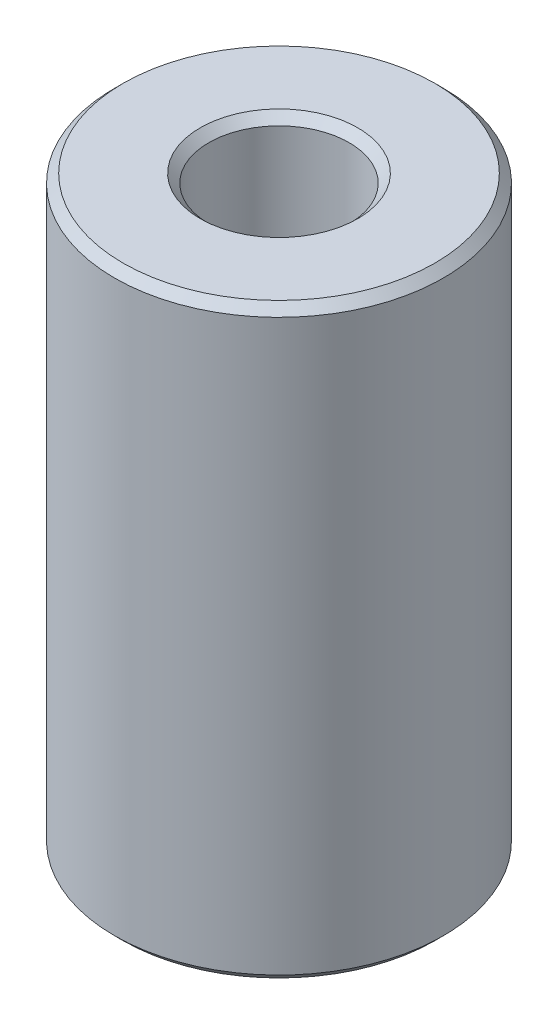
from build123d import *

# Parameters (mm, degrees)
SKETCH1_R           = 32.5
BOSS_EXTRUDE1_DEPTH = 115.995001946
SKETCH2_R           = 13.876048526
CUT_EXTRUDE1_DEPTH  = 125.769148736
CHAMFER1_SIZE       = 1.697379722


with BuildPart() as part:
    # Sketch1 → Boss-Extrude1 (new body)
    with BuildSketch(Plane(origin=(0, 0, 0), x_dir=(1, 0, 0), z_dir=(0, 1, 0))):
        Circle(SKETCH1_R)
    extrude(amount=BOSS_EXTRUDE1_DEPTH)

    # Sketch2 → Cut-Extrude1 (cut, through all)
    with BuildSketch(Plane(origin=(0, 0, 0), x_dir=(1, 0, 0), z_dir=(0, 1, 0))):
        Circle(SKETCH2_R)
    extrude(amount=CUT_EXTRUDE1_DEPTH, mode=Mode.SUBTRACT)

    # Chamfer1
    chamfer1_edges = [part.edges().sort_by_distance(p)[0] for p in [
        (-13.876048526, 115.995001946, 0),
        (-13.876048526, 0, 0),
        (-32.5, 0, 0),
        (-32.5, 115.995001946, 0),
    ]]
    chamfer(chamfer1_edges, length=CHAMFER1_SIZE)


solid = part.part
